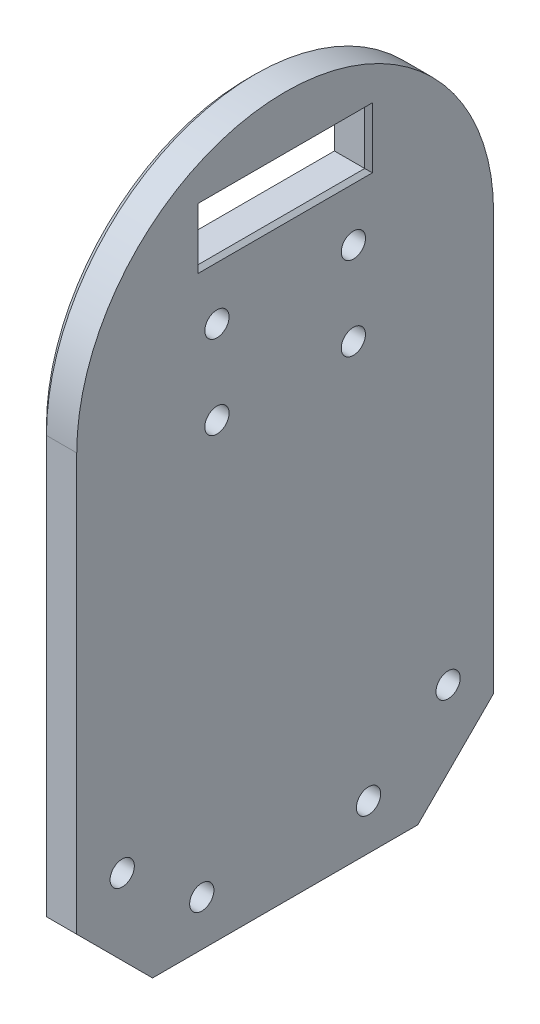
from build123d import *

# Parameters (mm, degrees)
EXTRUDE_1_DEPTH     = 5
SKETCH_2_R          = 1.6
CUT_EXTRUDE_1_DEPTH = 5
CHAMFER_1_SIZE      = 1
SKETCH_4_W          = 22
SKETCH_4_H          = 7
CUT_EXTRUDE_4_DEPTH = 10
CHAMFER_2_SIZE      = 0.5
SKETCH_3_R          = 1.6
CUT_EXTRUDE_5_DEPTH = 10


with BuildPart() as part:
    # 草图1 → 凸台-拉伸1 (new body)
    with BuildSketch(Plane(origin=(0, 0, 0), x_dir=(0, 0, -1), z_dir=(1, 0, 0))):
        with BuildLine():
            Line((-27.5, 0), (-27.5, -55))
            Line((-27.5, -55), (-17.5, -65))
            Line((-17.5, -65), (17.5, -65))
            Line((17.5, -65), (27.5, -55))
            Line((27.5, -55), (27.5, 0))
            ThreePointArc((27.5, 0), (0, 27.5), (-27.5, 0))
        make_face()
    extrude(amount=EXTRUDE_1_DEPTH)

    # 草图2 → 切除-拉伸1 (cut)
    with BuildSketch(Plane(origin=(5, 0, 0), x_dir=(0, 0, -1), z_dir=(1, 0, 0))):
        with Locations((-9, 5.5)):
            Circle(SKETCH_2_R)
        with Locations((9, 5.5)):
            Circle(SKETCH_2_R)
        with Locations((9, -5.5)):
            Circle(SKETCH_2_R)
        with Locations((-9, -5.5)):
            Circle(SKETCH_2_R)
    extrude(amount=-CUT_EXTRUDE_1_DEPTH, mode=Mode.SUBTRACT)

    # 倒角1
    chamfer_1_edges = [part.edges().sort_by_distance(p)[0] for p in [
        (0, -27.5, -27.5),
        (0, -27.5, 27.5),
        (0, 27.5, 0),
        (0, -65, 0),
        (0, -60, 22.5),
        (0, -60, -22.5),
    ]]
    chamfer(chamfer_1_edges, length=CHAMFER_1_SIZE)

    # 草图4 → 切除-拉伸4 (cut)
    with BuildSketch(Plane.ZY):
        with Locations((0, 16.5)):
            Rectangle(SKETCH_4_W, SKETCH_4_H)
    extrude(amount=-CUT_EXTRUDE_4_DEPTH, mode=Mode.SUBTRACT)

    # 倒角2
    chamfer_2_edges = [part.edges().sort_by_distance(p)[0] for p in [
        (0, 16.5, 11),
        (0, 20, 0),
        (0, 16.5, -11),
        (0, 13, 0),
        (5, 16.5, 11),
        (5, 20, 0),
        (5, 16.5, -11),
        (5, 13, 0),
    ]]
    chamfer(chamfer_2_edges, length=CHAMFER_2_SIZE)

    # 草图3 → 切除-拉伸5 (cut)
    with BuildSketch(Plane(origin=(5, 0, 0), x_dir=(0, 0, -1), z_dir=(1, 0, 0))):
        with Locations((21.5, -51)):
            Circle(SKETCH_3_R)
        with Locations((11, -59)):
            Circle(SKETCH_3_R)
    cut_extrude_5 = extrude(amount=-CUT_EXTRUDE_5_DEPTH, mode=Mode.SUBTRACT)

    # 镜向1: 切除-拉伸5 across plane
    add(cut_extrude_5.mirror(Plane.XY), mode=Mode.SUBTRACT)


solid = part.part
